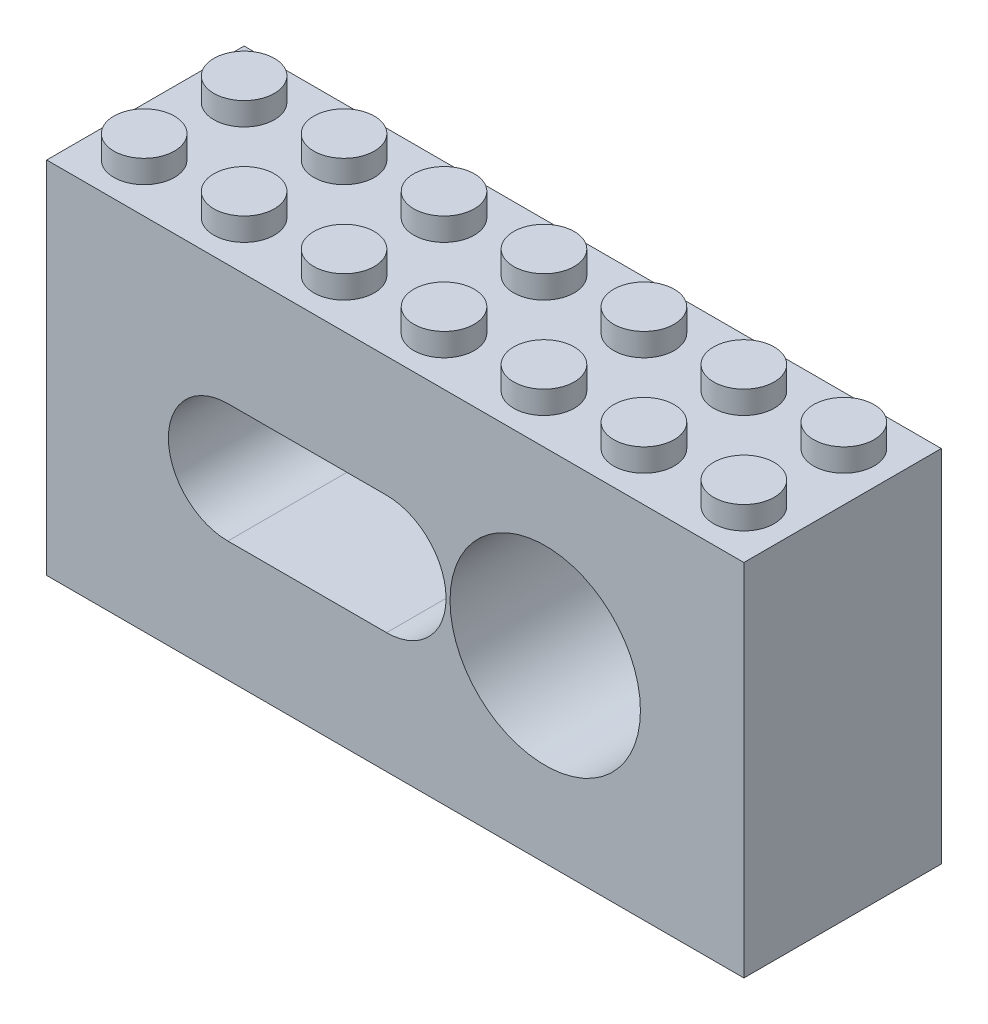
from build123d import *

# Parameters (mm, degrees)
SKETCH1_W           = 55.8
SKETCH1_H           = 15.8
BOSS_EXTRUDE1_DEPTH = 28.8
SKETCH2_R           = 7.62
CUT_EXTRUDE1_DEPTH  = 12.7
SKETCH4_R           = 2.778125
SKETCH4_R_2         = 1.8415
CUT_EXTRUDE2_DEPTH  = 12.7
CUT_EXTRUDE6_START  = -1.905
CUT_EXTRUDE6_DEPTH  = 1.905
SKETCH6_R           = 2.425
BOSS_EXTRUDE2_DEPTH = 1.83
SKETCH7_W           = 53.36
SKETCH7_H           = 13.36
SKETCH7_R           = 3.2625
CUT_EXTRUDE7_DEPTH  = 3


with BuildPart() as part:
    # Sketch1 → Boss-Extrude1 (new body)
    with BuildSketch(Plane(origin=(0, 0, 0), x_dir=(1, 0, 0), z_dir=(0, 1, 0))):
        with Locations((-11.199948696, 8.193463303)):
            Rectangle(SKETCH1_W, SKETCH1_H)
    extrude(amount=BOSS_EXTRUDE1_DEPTH)

    # Sketch2 → Cut-Extrude1 (cut)
    with BuildSketch(Plane.XY.offset(-0.293463303)):
        with Locations((0.800051304, 14.4)):
            Circle(SKETCH2_R)
        with BuildLine():
            Line((-11.899948696, 9.6375), (-24.599948696, 9.6375))
            ThreePointArc((-24.599948696, 9.6375), (-29.362448696, 14.4), (-24.599948696, 19.1625))
            Line((-24.599948696, 19.1625), (-11.899948696, 19.1625))
            ThreePointArc((-11.899948696, 19.1625), (-7.137448696, 14.4), (-11.899948696, 9.6375))
        make_face()
    extrude(amount=-CUT_EXTRUDE1_DEPTH, mode=Mode.SUBTRACT)

    # Sketch4 → Cut-Extrude2 (cut)
    with BuildSketch(Plane(origin=(0, 0, -16.093463303), x_dir=(-1, 0, 0), z_dir=(0, 0, -1))):
        with Locations((-0.800051304, 14.4)):
            Circle(SKETCH4_R)
        with Locations((11.899948696, 14.4)):
            Circle(SKETCH4_R_2)
        with Locations((24.599948696, 14.4)):
            Circle(SKETCH4_R_2)
    extrude(amount=-CUT_EXTRUDE2_DEPTH, mode=Mode.SUBTRACT)

    # Sketch5 → Cut-Extrude6 (cut)
    with BuildSketch(Plane(origin=(0, 0, -16.093463303), x_dir=(-1, 0, 0), z_dir=(0, 0, -1)).offset(CUT_EXTRUDE6_START)):
        with BuildLine():
            Line((24.599948696, 19.1625), (11.899948696, 19.1625))
            ThreePointArc((11.899948696, 19.1625), (7.137448696, 14.4), (11.899948696, 9.6375))
            Line((11.899948696, 9.6375), (24.599948696, 9.6375))
            ThreePointArc((24.599948696, 9.6375), (29.362448696, 14.4), (24.599948696, 19.1625))
        make_face()
    extrude(amount=CUT_EXTRUDE6_DEPTH, mode=Mode.SUBTRACT)

    # Sketch6 → Boss-Extrude2 (add)
    with BuildSketch(Plane(origin=(0, 28.8, 0), x_dir=(1, 0, 0), z_dir=(0, 1, 0))):
        with Locations((12.800051304, 12.193463303)):
            Circle(SKETCH6_R)
        with Locations((12.800051304, 4.193463303)):
            Circle(SKETCH6_R)
        with Locations((4.800051304, 12.193463303)):
            Circle(SKETCH6_R)
        with Locations((4.800051304, 4.193463303)):
            Circle(SKETCH6_R)
        with Locations((-3.199948696, 12.193463303)):
            Circle(SKETCH6_R)
        with Locations((-3.199948696, 4.193463303)):
            Circle(SKETCH6_R)
        with Locations((-11.199948696, 12.193463303)):
            Circle(SKETCH6_R)
        with Locations((-11.199948696, 4.193463303)):
            Circle(SKETCH6_R)
        with Locations((-19.199948696, 12.193463303)):
            Circle(SKETCH6_R)
        with Locations((-19.199948696, 4.193463303)):
            Circle(SKETCH6_R)
        with Locations((-27.199948696, 12.193463303)):
            Circle(SKETCH6_R)
        with Locations((-27.199948696, 4.193463303)):
            Circle(SKETCH6_R)
        with Locations((-35.199948696, 12.193463303)):
            Circle(SKETCH6_R)
        with Locations((-35.199948696, 4.193463303)):
            Circle(SKETCH6_R)
    extrude(amount=BOSS_EXTRUDE2_DEPTH)

    # Sketch7 → Cut-Extrude7 (cut)
    with BuildSketch(Plane.XZ):
        with Locations((-11.199948696, -8.193463303)):
            Rectangle(SKETCH7_W, SKETCH7_H)
        with Locations((-31.199948696, -8.193463303)):
            Circle(SKETCH7_R, mode=Mode.SUBTRACT)
        with Locations((-23.199948696, -8.193463303)):
            Circle(SKETCH7_R, mode=Mode.SUBTRACT)
        with Locations((-15.199948696, -8.193463303)):
            Circle(SKETCH7_R, mode=Mode.SUBTRACT)
        with Locations((-7.199948696, -8.193463303)):
            Circle(SKETCH7_R, mode=Mode.SUBTRACT)
        with Locations((0.800051304, -8.193463303)):
            Circle(SKETCH7_R, mode=Mode.SUBTRACT)
        with Locations((8.800051304, -8.193463303)):
            Circle(SKETCH7_R, mode=Mode.SUBTRACT)
    extrude(amount=-CUT_EXTRUDE7_DEPTH, mode=Mode.SUBTRACT)


solid = part.part
